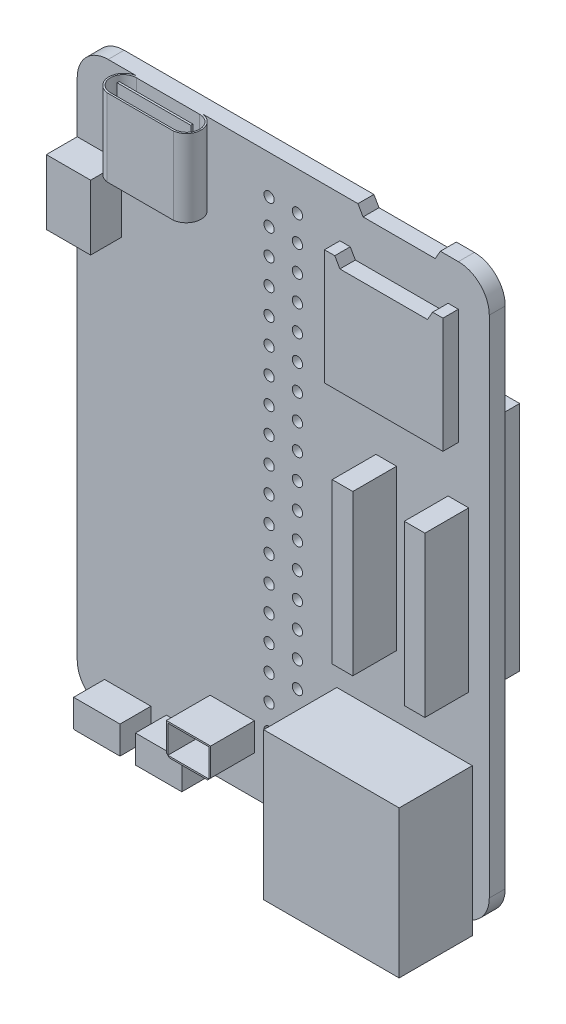
from build123d import *

# Parameters (mm, degrees)
SKETCH1_W            = 55
SKETCH1_H            = 40
BOSS_EXTRUDE1_DEPTH  = 1.55
FILLET1_R            = 3
SKETCH2_W            = 13.15
SKETCH2_H            = 14.3
BOSS_EXTRUDE2_DEPTH  = 7.1
SKETCH3_W            = 12.5
SKETCH3_H            = 6.5
SKETCH3_W_2          = 11.1
SKETCH3_H_2          = 1.497681088
CUT_EXTRUDE1_DEPTH   = 13.3
SKETCH4_W            = 8.95
SKETCH4_H            = 7.5
BOSS_EXTRUDE3_DEPTH  = 2.85
CUT_EXTRUDE2_DEPTH   = 7.5
SKETCH5_3_W          = 7.15
SKETCH5_3_H          = 0.2
CUT_EXTRUDE3_DEPTH   = 7
BOSS_EXTRUDE4_DEPTH  = 1.5
CUT_EXTRUDE4_DEPTH   = 10
BOSS_EXTRUDE5_START  = 3
SKETCH8_W            = 4.5
SKETCH8_H            = 2.7
BOSS_EXTRUDE5_DEPTH  = 3
SKETCH9_R            = 1
BOSS_EXTRUDE6_DEPTH  = 0.5
SKETCH10_W           = 2
SKETCH10_H           = 15.5
BOSS_EXTRUDE7_DEPTH  = 4.25
SKETCH8_4_W          = 4.3
SKETCH8_4_H          = 3
BOSS_EXTRUDE9_DEPTH  = 4.25
SHELL2_T             = -0.15
CHAMFER1_SIZE        = 0.3
SKETCH11_R           = 0.5
CUT_EXTRUDE5_DEPTH   = 1.55
SKETCH12_W           = 4.3
SKETCH12_H           = 6.3
BOSS_EXTRUDE10_DEPTH = 3
SHELL3_T             = -0.2
SKETCH13_W           = 2.9
SKETCH13_H           = 22.5
BOSS_EXTRUDE11_DEPTH = 3


with BuildPart() as part:
    # Sketch1 → Boss-Extrude1 (new body)
    with BuildSketch(Plane(origin=(0, 0, 0), x_dir=(0, 1, 0), z_dir=(0, 0, 1))):
        Rectangle(SKETCH1_W, SKETCH1_H)
    extrude(amount=BOSS_EXTRUDE1_DEPTH)

    # Fillet1
    fillet1_edges = [part.edges().sort_by_distance(p)[0] for p in [
        (20, 27.5, 0.775),
        (20, -27.5, 0.775),
        (-20, -27.5, 0.775),
        (-20, 27.5, 0.775),
    ]]
    fillet(fillet1_edges, radius=FILLET1_R)

    # Sketch2 → Boss-Extrude2 (add)
    with BuildSketch(Plane.XY.offset(1.55)):
        with Locations((11.775, -21.35)):
            Rectangle(SKETCH2_W, SKETCH2_H)
    extrude(amount=BOSS_EXTRUDE2_DEPTH)

    # Sketch3 → Cut-Extrude1 (cut)
    with BuildSketch(Plane.XZ.offset(28.5)):
        with Locations((11.775, 5.1)):
            Rectangle(SKETCH3_W, SKETCH3_H)
        with Locations((11.775, 6.101159456)):
            Rectangle(SKETCH3_W_2, SKETCH3_H_2, mode=Mode.SUBTRACT)
    extrude(amount=-CUT_EXTRUDE1_DEPTH, mode=Mode.SUBTRACT)

    # Sketch4 → Boss-Extrude3 (add)
    with BuildSketch(Plane.XY.offset(1.55)):
        with Locations((-11.025, 23.75)):
            Rectangle(SKETCH4_W, SKETCH4_H)
    extrude(amount=BOSS_EXTRUDE3_DEPTH)

    # Sketch5 → Cut-Extrude2 (cut)
    with BuildSketch(Plane(origin=(0, 27.5, 0), x_dir=(-1, 0, 0), z_dir=(0, 1, 0))):
        with BuildLine():
            Line((6.55, 4.4), (6.55, 2.975))
            ThreePointArc((6.55, 2.975), (6.910359128, 3.926260685), (7.810540583, 4.4))
            Line((7.810540583, 4.4), (6.55, 4.4))
        make_face()
        with BuildLine():
            Line((6.55, 1.55), (7.810540583, 1.55))
            ThreePointArc((7.810540583, 1.55), (6.910359128, 2.023739315), (6.55, 2.975))
            Line((6.55, 2.975), (6.55, 1.55))
        make_face()
        with BuildLine():
            Line((15.5, 1.55), (15.5, 2.975))
            ThreePointArc((15.5, 2.975), (15.139640872, 2.023739315), (14.239459417, 1.55))
            Line((14.239459417, 1.55), (15.5, 1.55))
        make_face()
        with BuildLine():
            Line((15.5, 4.4), (14.239459417, 4.4))
            ThreePointArc((14.239459417, 4.4), (15.139640872, 3.926260685), (15.5, 2.975))
            Line((15.5, 2.975), (15.5, 4.4))
        make_face()
    extrude(amount=-CUT_EXTRUDE2_DEPTH, mode=Mode.SUBTRACT)

    # Sketch5<3> → Cut-Extrude3 (cut)
    with BuildSketch(Plane(origin=(0, 27.5, 0), x_dir=(-1, 0, 0), z_dir=(0, 1, 0))):
        with BuildLine():
            Line((7.95, 1.719461162), (14.1, 1.719461162))
            ThreePointArc((14.1, 1.719461162), (15.355538838, 2.975), (14.1, 4.230538838))
            Line((14.1, 4.230538838), (7.95, 4.230538838))
            ThreePointArc((7.95, 4.230538838), (6.694461162, 2.975), (7.95, 1.719461162))
        make_face()
        with Locations((11.025, 2.975)):
            Rectangle(SKETCH5_3_W, SKETCH5_3_H, mode=Mode.SUBTRACT)
    extrude(amount=-CUT_EXTRUDE3_DEPTH, mode=Mode.SUBTRACT)

    # Sketch6 → Boss-Extrude4 (add)
    with BuildSketch(Plane.XY.offset(1.55)):
        Polygon((16, 23.5), (15.5, 22.633974596), (7, 22.633974596), (6.5, 23.5), (5.5, 23.5), (5.5, 12.3), (17, 12.3), (17, 23.5), align=None)
    extrude(amount=BOSS_EXTRUDE4_DEPTH)

    # Sketch7 → Cut-Extrude4 (cut)
    with BuildSketch(Plane.XY.offset(1.55)):
        Polygon((7.25, 27.5), (7.75, 26.633974596), (14.75, 26.633974596), (15.25, 27.5), align=None)
    extrude(amount=-CUT_EXTRUDE4_DEPTH, mode=Mode.SUBTRACT)

    # Sketch8 → Boss-Extrude5 (add)
    with BuildSketch(Plane.XY.offset(1.55).offset(BOSS_EXTRUDE5_START)):
        with BuildLine():
            ThreePointArc((-17.35, -27.479513383), (-17.17529953, -27.494873966), (-17, -27.5))
            Line((-17, -27.5), (-12.85, -27.5))
            Line((-12.85, -27.5), (-12.85, -24.8))
            Line((-12.85, -24.8), (-17.35, -24.8))
            Line((-17.35, -24.8), (-17.35, -27.479513383))
        make_face()
        with Locations((-9.1, -26.15)):
            Rectangle(SKETCH8_W, SKETCH8_H)
    extrude(amount=-BOSS_EXTRUDE5_DEPTH)

    # Sketch9 → Boss-Extrude6 (add)
    with BuildSketch(Plane.XZ.offset(27.5)):
        with Locations(Location((-9.1, 3.05, 0), (0, 0, 270))):
            Circle(SKETCH9_R)
        with Locations(Location((-15.1, 3.05, 0), (0, 0, 90))):
            Circle(SKETCH9_R)
    extrude(amount=BOSS_EXTRUDE6_DEPTH)

    # Sketch10 → Boss-Extrude7 (add)
    with BuildSketch(Plane.XY.offset(1.55)):
        with Locations((17, -0.45)):
            Rectangle(SKETCH10_W, SKETCH10_H)
        with Locations((10, -0.45)):
            Rectangle(SKETCH10_W, SKETCH10_H)
    extrude(amount=BOSS_EXTRUDE7_DEPTH)


with BuildPart() as body_2:
    # Sketch8<4> → Boss-Extrude9 (new body)
    with BuildSketch(Plane.XY.offset(1.55)):
        with Locations((-4.95, -22.5)):
            Rectangle(SKETCH8_4_W, SKETCH8_4_H)
    extrude(amount=BOSS_EXTRUDE9_DEPTH)

    # Shell2
    shell2_openings = [body_2.faces().sort_by_distance(p)[0] for p in [
        (-4.95, -22.5, 5.8),
    ]]
    offset(amount=SHELL2_T, openings=shell2_openings, kind=Kind.INTERSECTION)


with BuildPart() as part_1:
    add(part.part)

    # Combine1: union body 2
    add(body_2.part)

    # Chamfer1
    chamfer1_edges = [part_1.edges().sort_by_distance(p)[0] for p in [
        (-2.8, -24, 3.675),
        (-7.1, -24, 3.675),
    ]]
    chamfer(chamfer1_edges, length=CHAMFER1_SIZE - 0.0001)  # a hair under: the kernel refuses the full size

    # Sketch11 → Cut-Extrude5 (cut)
    with BuildSketch(Plane.XY.offset(1.55)):
        with Locations((1.375, 23.75)):
            Circle(SKETCH11_R)
        with Locations((1.375, 21.25)):
            Circle(SKETCH11_R)
        with Locations((1.375, 18.75)):
            Circle(SKETCH11_R)
        with Locations((1.375, 16.25)):
            Circle(SKETCH11_R)
        with Locations((1.375, 13.75)):
            Circle(SKETCH11_R)
        with Locations((1.375, 11.25)):
            Circle(SKETCH11_R)
        with Locations((1.375, 8.75)):
            Circle(SKETCH11_R)
        with Locations((1.375, 6.25)):
            Circle(SKETCH11_R)
        with Locations((1.375, 3.75)):
            Circle(SKETCH11_R)
        with Locations((1.375, 1.25)):
            Circle(SKETCH11_R)
        with Locations((1.375, -1.25)):
            Circle(SKETCH11_R)
        with Locations((1.375, -3.75)):
            Circle(SKETCH11_R)
        with Locations((1.375, -6.25)):
            Circle(SKETCH11_R)
        with Locations((1.375, -8.75)):
            Circle(SKETCH11_R)
        with Locations((1.375, -11.25)):
            Circle(SKETCH11_R)
        with Locations((1.375, -13.75)):
            Circle(SKETCH11_R)
        with Locations((1.375, -16.25)):
            Circle(SKETCH11_R)
        with Locations((1.375, -18.75)):
            Circle(SKETCH11_R)
        with Locations((1.375, -21.25)):
            Circle(SKETCH11_R)
        with Locations((1.375, -23.75)):
            Circle(SKETCH11_R)
        with Locations(Location((-1.375, -23.75, 0), (0, 0, 180))):
            Circle(SKETCH11_R)
        with Locations(Location((-1.375, -21.25, 0), (0, 0, 180))):
            Circle(SKETCH11_R)
        with Locations(Location((-1.375, -18.75, 0), (0, 0, 180))):
            Circle(SKETCH11_R)
        with Locations(Location((-1.375, -16.25, 0), (0, 0, 180))):
            Circle(SKETCH11_R)
        with Locations(Location((-1.375, -13.75, 0), (0, 0, 180))):
            Circle(SKETCH11_R)
        with Locations(Location((-1.375, -11.25, 0), (0, 0, 180))):
            Circle(SKETCH11_R)
        with Locations(Location((-1.375, -8.75, 0), (0, 0, 180))):
            Circle(SKETCH11_R)
        with Locations(Location((-1.375, -6.25, 0), (0, 0, 180))):
            Circle(SKETCH11_R)
        with Locations(Location((-1.375, -3.75, 0), (0, 0, 180))):
            Circle(SKETCH11_R)
        with Locations(Location((-1.375, -1.25, 0), (0, 0, 180))):
            Circle(SKETCH11_R)
        with Locations(Location((-1.375, 1.25, 0), (0, 0, 180))):
            Circle(SKETCH11_R)
        with Locations(Location((-1.375, 3.75, 0), (0, 0, 180))):
            Circle(SKETCH11_R)
        with Locations(Location((-1.375, 6.25, 0), (0, 0, 180))):
            Circle(SKETCH11_R)
        with Locations(Location((-1.375, 8.75, 0), (0, 0, 180))):
            Circle(SKETCH11_R)
        with Locations(Location((-1.375, 11.25, 0), (0, 0, 180))):
            Circle(SKETCH11_R)
        with Locations(Location((-1.375, 13.75, 0), (0, 0, 180))):
            Circle(SKETCH11_R)
        with Locations(Location((-1.375, 16.25, 0), (0, 0, 180))):
            Circle(SKETCH11_R)
        with Locations(Location((-1.375, 18.75, 0), (0, 0, 180))):
            Circle(SKETCH11_R)
        with Locations(Location((-1.375, 23.75, 0), (0, 0, 180))):
            Circle(SKETCH11_R)
        with Locations(Location((-1.375, 21.25, 0), (0, 0, 180))):
            Circle(SKETCH11_R)
    extrude(amount=-CUT_EXTRUDE5_DEPTH, mode=Mode.SUBTRACT)

    # Sketch13 → Boss-Extrude11 (add)
    with BuildSketch(Plane(origin=(0, 0, 0), x_dir=(1, 0, 0), z_dir=(0, 0, -1))):
        with Locations((16.95, -2.75)):
            Rectangle(SKETCH13_W, SKETCH13_H)
        with Locations((-16.95, -2.75)):
            Rectangle(SKETCH13_W, SKETCH13_H)
    extrude(amount=BOSS_EXTRUDE11_DEPTH)


with BuildPart() as body_2_2:
    # Sketch12 → Boss-Extrude10 (new body)
    with BuildSketch(Plane.XY.offset(1.55)):
        with Locations((-17.85, 16.35)):
            Rectangle(SKETCH12_W, SKETCH12_H)
    extrude(amount=BOSS_EXTRUDE10_DEPTH)

    # Shell3
    shell3_openings = [body_2_2.faces().sort_by_distance(p)[0] for p in [
        (-20, 16.35, 3.05),
    ]]
    offset(amount=SHELL3_T, openings=shell3_openings, kind=Kind.INTERSECTION)


solid = Compound([part_1.part, body_2_2.part])
